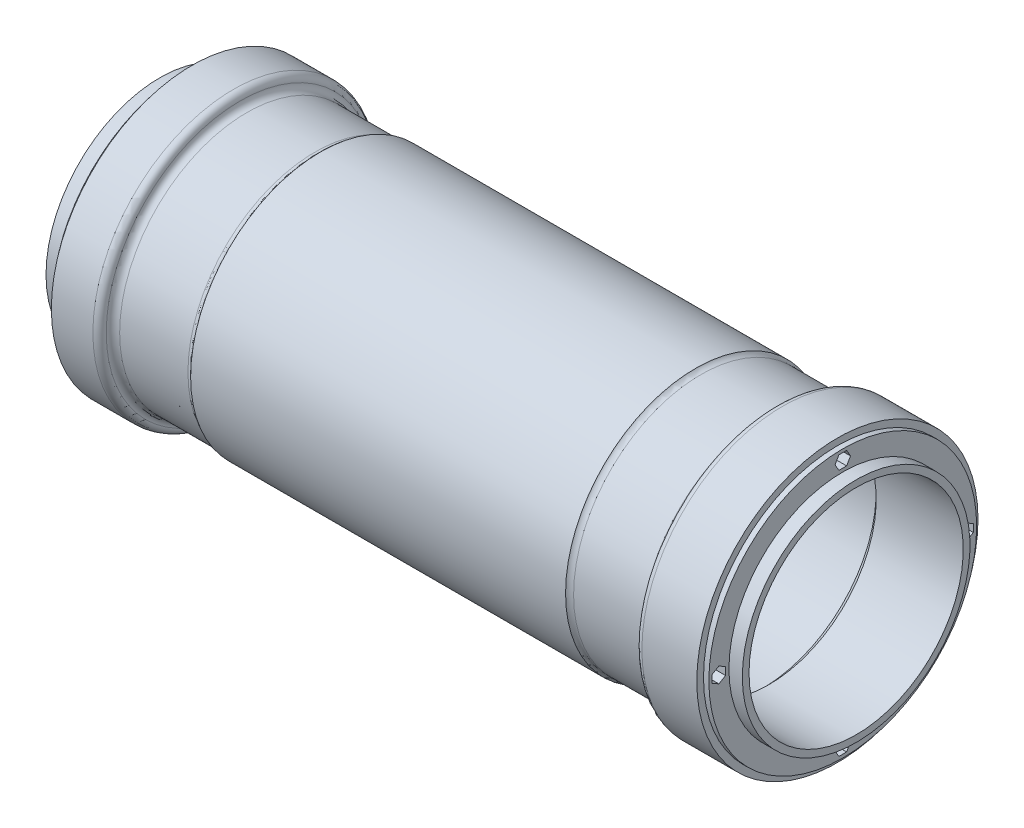
from build123d import *

# Parameters (mm, degrees)
CHAMFER5_SIZE      = 5
FILLET1_R          = 2.5
FILLET2_R          = 2.5
CUT_EXTRUDE1_DEPTH = 10
CUT_EXTRUDE2_DEPTH = 10


# Some blends are built 0.0001 mm under size
with BuildPart() as part:
    # Sketch2 → Revolve1 (revolve)
    with BuildSketch(Plane(origin=(0, 0, 0), x_dir=(1, 0, 0), z_dir=(0, 1, 0))):
        Polygon((100.5, -42.5), (-99.5, -42.5), (-99.5, -40), (-117.5, -40), (-117.5, -37.5), (-119.5, -37.5), (-119.5, -40), (-129.5, -40), (-129.5, -42.5), (-119.5, -42.5), (-119.5, -50), (-117.5, -50), (-117.5, -52.5), (-99.5, -52.5), (-99.5, -47.5), (-69.5, -47.5), (-69.5, -48.5), (70.5, -48.5), (70.5, -47.5), (100.5, -47.5), (100.5, -52.5), (123.5, -52.5), (123.5, -50), (125.5, -50), (125.5, -42.5), (130.5, -42.5), (130.5, -40), (100.5, -40), align=None)
    revolve(axis=Axis((-130, 0, 0), (1, 0, 0)))

    # Chamfer5
    # the kernel refuses this chamfer: 5 mm, written as the material it adds along each edge
    with BuildSketch(Plane(origin=(-117.5, 0, 0), x_dir=(0, 0, 1), z_dir=(0, 1, 0))) as chamfer5_piece_1_section:
        Polygon((40, CHAMFER5_SIZE), (40 - CHAMFER5_SIZE, 0), (40, 0), align=None)
    chamfer5_piece_1 = revolve(axis=Axis((-117.5, 0, 0), (1, 0, 0)), mode=Mode.PRIVATE)
    chamfer5_piece_1 = chamfer5_piece_1 - Plane(origin=(-113.775296331, 0, 0), x_dir=(0, 0, 1), z_dir=(-1, 0, 0)) * Cylinder(37.5, 161, mode=Mode.PRIVATE)
    add(chamfer5_piece_1)
    with BuildSketch(Plane(origin=(100.5, 0, 0), x_dir=(0, 0, 1), z_dir=(0, 1, 0))) as chamfer5_piece_2_section:
        Polygon((42.5, -CHAMFER5_SIZE), (42.5 - CHAMFER5_SIZE, 0), (42.5, 0), align=None)
    chamfer5_piece_2 = revolve(axis=Axis((100.5, 0, 0), (1, 0, 0)), mode=Mode.PRIVATE)
    chamfer5_piece_2 = chamfer5_piece_2 - Plane(origin=(96.777307506, 0, 0), x_dir=(0, 0, 1), z_dir=(-1, 0, 0)) * Cylinder(40, 170, mode=Mode.PRIVATE)
    add(chamfer5_piece_2)
    # the kernel refuses this chamfer: 5 mm, written as the material it takes off along each edge
    with BuildSketch(Plane(origin=(-99.5, 0, 0), x_dir=(0, 0, 1), z_dir=(0, 1, 0))) as chamfer5_2_piece_1_section:
        Polygon((40 + CHAMFER5_SIZE, 0), (40, -CHAMFER5_SIZE), (40, 0), align=None)
    chamfer5_2_piece_1 = revolve(axis=Axis((-99.5, 0, 0), (1, 0, 0)), mode=Mode.PRIVATE)
    chamfer5_2_piece_1 = chamfer5_2_piece_1 & Plane(origin=(-103.223022752, 0, 0), x_dir=(0, 0, 1), z_dir=(-1, 0, 0)) * Cylinder(42.5, 181, mode=Mode.PRIVATE)
    add(chamfer5_2_piece_1, mode=Mode.SUBTRACT)

    # Fillet1
    # the kernel refuses this fillet: 2.5 mm, written as the material it adds along each edge
    with BuildSketch(Plane(origin=(-99.5, 0, 0), x_dir=(0, 0, 1), z_dir=(0, 1, 0))) as fillet1_piece_1:
        with BuildLine():
            CenterArc((47.5 + FILLET1_R, FILLET1_R), FILLET1_R, 180, 90)
            Line((47.5 + FILLET1_R, 0), (47.5 + FILLET1_R, -FILLET1_R * 0.02))
            Line((47.5 + FILLET1_R, -FILLET1_R * 0.02), (47.5 - FILLET1_R * 0.02, -FILLET1_R * 0.02))
            Line((47.5 - FILLET1_R * 0.02, -FILLET1_R * 0.02), (47.5 - FILLET1_R * 0.02, FILLET1_R))
            Line((47.5 - FILLET1_R * 0.02, FILLET1_R), (47.5, FILLET1_R))
        make_face()
    revolve(axis=Axis((-99.5, 0, 0), (1, 0, 0)))
    with BuildSketch(Plane(origin=(-69.5, 0, 0), x_dir=(0, 0, 1), z_dir=(0, 1, 0))) as fillet1_piece_2:
        with BuildLine():
            CenterArc((50, -2), FILLET1_R, 126.869897646, 53.130102354)
            Line((47.5, -2), (47.45, -2))
            Line((47.45, -2), (47.45, 0))
            Line((47.45, 0), (47.5, 0.05))
            ThreePointArc((47.5, 0.05), (48, 0.05), (48.47, 0.04))
            Line((48.47, 0.04), (48.5, 0))
        make_face()
    revolve(axis=Axis((-69.5, 0, 0), (1, 0, 0)))
    with BuildSketch(Plane(origin=(70.5, 0, 0), x_dir=(0, 0, 1), z_dir=(0, 1, 0))) as fillet1_piece_3:
        with BuildLine():
            CenterArc((50, 2), FILLET1_R, 180, 53.130102354)
            Line((48.5, 0), (48.47, -0.04))
            ThreePointArc((48.47, -0.04), (48, -0.05), (47.5, -0.05))
            Line((47.5, -0.05), (47.45, 0))
            Line((47.45, 0), (47.45, 2))
            Line((47.45, 2), (47.5, 2))
        make_face()
    revolve(axis=Axis((70.5, 0, 0), (1, 0, 0)))
    with BuildSketch(Plane(origin=(100.5, 0, 0), x_dir=(0, 0, 1), z_dir=(0, 1, 0))) as fillet1_piece_4:
        with BuildLine():
            CenterArc((47.5 + FILLET1_R, -FILLET1_R), FILLET1_R, 90, 90)
            Line((47.5, -FILLET1_R), (47.5 - FILLET1_R * 0.02, -FILLET1_R))
            Line((47.5 - FILLET1_R * 0.02, -FILLET1_R), (47.5 - FILLET1_R * 0.02, FILLET1_R * 0.02))
            Line((47.5 - FILLET1_R * 0.02, FILLET1_R * 0.02), (47.5 + FILLET1_R, FILLET1_R * 0.02))
            Line((47.5 + FILLET1_R, FILLET1_R * 0.02), (47.5 + FILLET1_R, 0))
        make_face()
    revolve(axis=Axis((100.5, 0, 0), (1, 0, 0)))

    # Fillet2
    fillet2_edges = [part.edges().sort_by_distance(p)[0] for p in [
        (-99.5, 0, -52.5),
        (100.5, 0, -52.5),
    ]]
    fillet(fillet2_edges, radius=FILLET2_R - 0.0001)  # a hair under: the kernel refuses the full size

    # Sketch3 → Cut-Extrude1 (cut)
    with BuildSketch(Plane.ZY.offset(119.5)):
        Polygon((2.886751346, 46.25), (1.443375673, 48.75), (-1.443375673, 48.75), (-2.886751346, 46.25), (-1.443375673, 43.75), (1.443375673, 43.75), align=None)
        Polygon((46.25, -2.886751346), (48.75, -1.443375673), (48.75, 1.443375673), (46.25, 2.886751346), (43.75, 1.443375673), (43.75, -1.443375673), align=None)
        Polygon((-46.25, -2.886751346), (-43.75, -1.443375673), (-43.75, 1.443375673), (-46.25, 2.886751346), (-48.75, 1.443375673), (-48.75, -1.443375673), align=None)
        Polygon((2.886751346, -46.25), (1.443375673, -43.75), (-1.443375673, -43.75), (-2.886751346, -46.25), (-1.443375673, -48.75), (1.443375673, -48.75), align=None)
    extrude(amount=-CUT_EXTRUDE1_DEPTH, mode=Mode.SUBTRACT)

    # Sketch5 → Cut-Extrude2 (cut)
    with BuildSketch(Plane(origin=(125.5, 0, 0), x_dir=(0, 0, -1), z_dir=(1, 0, 0))):
        Polygon((2.886751346, 46.25), (1.443375673, 48.75), (-1.443375673, 48.75), (-2.886751346, 46.25), (-1.443375673, 43.75), (1.443375673, 43.75), align=None)
        Polygon((46.25, -2.886751346), (48.75, -1.443375673), (48.75, 1.443375673), (46.25, 2.886751346), (43.75, 1.443375673), (43.75, -1.443375673), align=None)
        Polygon((2.886751346, -46.25), (1.443375673, -43.75), (-1.443375673, -43.75), (-2.886751346, -46.25), (-1.443375673, -48.75), (1.443375673, -48.75), align=None)
        Polygon((-46.25, -2.886751346), (-43.75, -1.443375673), (-43.75, 1.443375673), (-46.25, 2.886751346), (-48.75, 1.443375673), (-48.75, -1.443375673), align=None)
    extrude(amount=-CUT_EXTRUDE2_DEPTH, mode=Mode.SUBTRACT)


solid = part.part
